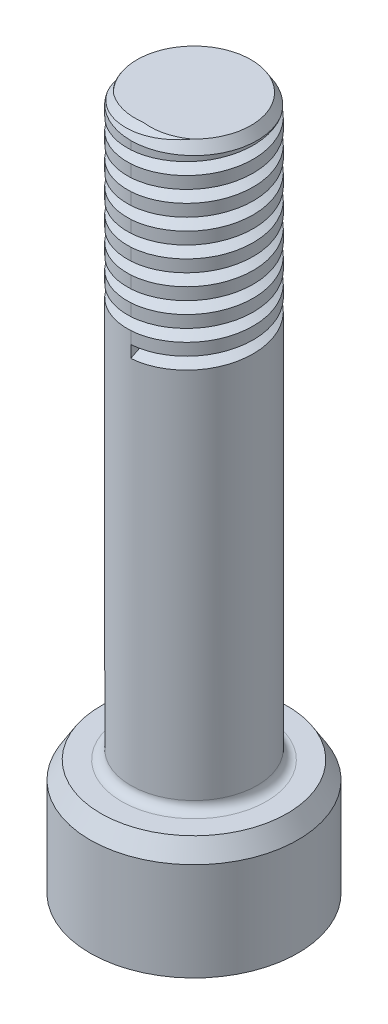
from build123d import *

# Parameters (mm, degrees)
CUT_SWEEP1_PITCH   = 0.793751588
CUT_EXTRUDE1_DEPTH = 1.955803912
FILLET1_R          = 0.30480061
FILLET2_R          = 0.396875794
CHAMFER3_SIZE      = 0.127


with BuildPart() as part:
    # Sketch1 → Revolve1 (revolve)
    with BuildSketch(Plane.XY, mode=Mode.PRIVATE) as revolve1_sk:
        Polygon((0, 0), (0, 23.215608331), (2.082804166, 23.215608331), (2.082804166, 4.165608331), (3.429006858, 4.165608331), (3.429006858, 0), align=None)
    revolve(revolve1_sk.sketch.rotate(Axis((0, 0, 0), (0, 1, 0)), 90), axis=Axis((0, 0, 0), (0, 1, 0)))

    # Cut-Sweep1: arcs per turn and ends read off the stored shape
    # Cut-Sweep1: the profile of Sketch3 profile screwed along a right-hand helix through 9 turns, 8 arcs to a turn; built about Z, then put on its axis
    cut_sweep1_z = Axis((0, 0, 0), (0, 0, 1))
    cut_sweep1_corners = [(2.083104166, 0, -0.595163691), (2.083104166, 0, -0.992339484), (1.685928372, 0, -0.793751588)]
    with BuildLine(mode=Mode.PRIVATE) as cut_sweep1_profile:
        Line(cut_sweep1_corners[0], cut_sweep1_corners[1])
        Line(cut_sweep1_corners[1], cut_sweep1_corners[2])
        Line(cut_sweep1_corners[2], cut_sweep1_corners[0])
    cut_sweep1_cap = Face(cut_sweep1_profile.wire())
    cut_sweep1_turn_angles = [0, 22.5, 45, 67.5, 90, 112.5, 135, 157.5, 180, 202.5, 225, 247.5, 270, 292.5, 315, 337.5, 360]
    cut_sweep1_turn_weights = [1, 0.9238795325112867, 1, 0.9238795325112867, 1, 0.9238795325112867, 1, 0.9238795325112867, 1, 0.9238795325112867, 1, 0.9238795325112867, 1, 0.9238795325112867, 1, 0.9238795325112867, 1]
    cut_sweep1_turn_rails = [Edge.make_bspline([Vector(p[0], p[1], 0).rotate(cut_sweep1_z, cut_sweep1_turn_angles[k]) / cut_sweep1_turn_weights[k] + Vector(0, 0, p[2] + CUT_SWEEP1_PITCH * cut_sweep1_turn_angles[k] / 360) for k in range(17)], [0, 0, 0, 1, 1, 2, 2, 3, 3, 4, 4, 5, 5, 6, 6, 7, 7, 8, 8, 8], 2, cut_sweep1_turn_weights) for p in cut_sweep1_corners]
    cut_sweep1_turn_sides = [Face.make_surface_from_curves(cut_sweep1_turn_rails[p[0]], cut_sweep1_turn_rails[p[1]]) for p in [(0, 1), (1, 2), (2, 0)]]
    cut_sweep1 = Plane(origin=(0, 23.215608331, 0), x_dir=(0, 0, 1), z_dir=(0, -1, 0)) * Solid(Shell([*[p.moved(Location((0, 0, CUT_SWEEP1_PITCH * i))) for i in range(9) for p in cut_sweep1_turn_sides], cut_sweep1_cap, cut_sweep1_cap.rotate(cut_sweep1_z, 3240).moved(Location((0, 0, CUT_SWEEP1_PITCH * 3240 / 360)))]))
    add(cut_sweep1, mode=Mode.SUBTRACT)

    # Sketch4 → Cut-Extrude1 (cut)
    with BuildSketch(Plane(origin=(0, 0, 0), x_dir=(1, 0, 0), z_dir=(0, 1, 0))):
        Polygon((0, 2.06772639), (-1.790703581, 1.033863195), (-1.790703581, -1.033863195), (0, -2.06772639), (1.790703581, -1.033863195), (1.790703581, 1.033863195), align=None)
    extrude(amount=CUT_EXTRUDE1_DEPTH, mode=Mode.SUBTRACT)

    # Fillet1
    fillet1_edges = [part.edges().sort_by_distance(p)[0] for p in [
        (0, 4.165608331, 2.082804166),
    ]]
    fillet(fillet1_edges, radius=FILLET1_R)

    # Fillet2
    fillet2_edges = [part.edges().sort_by_distance(p)[0] for p in [
        (1.790703581, 0.977901956, -1.033863195),
        (0, 0.977901956, -2.06772639),
        (-1.790703581, 0.977901956, -1.033863195),
        (-1.790703581, 0.977901956, 1.033863195),
        (0, 0.977901956, 2.06772639),
        (1.790703581, 0.977901956, 1.033863195),
        (0.895351791, 1.955803912, -1.550794792),
        (-0.895351791, 1.955803912, -1.550794792),
        (-1.790703581, 1.955803912, 0),
        (-0.895351791, 1.955803912, 1.550794792),
        (0.895351791, 1.955803912, 1.550794792),
        (1.790703581, 1.955803912, 0),
    ]]
    fillet(fillet2_edges, radius=FILLET2_R)

    # Chamfer1: read off the stored shape, not the designer's step
    # Chamfer1 outline → Chamfer1 (revolve, cut)
    with BuildSketch(Plane.XY):
        Polygon((2.082804166, 23.215608331), (1.879603759, 23.215608331), (2.082804166, 22.886469354), align=None)
    revolve(axis=Axis((0, 0, 0), (0, 1, 0)), mode=Mode.SUBTRACT)

    # Chamfer2: read off the stored shape, not the designer's step
    # Chamfer2 outline → Chamfer2 (revolve, cut)
    with BuildSketch(Plane.XY):
        Polygon((2.853013648, 0), (3.429006858, 0), (3.429006858, 0.355600711), align=None)
        Polygon((3.073406147, 4.165608331), (3.429006858, 3.589615121), (3.429006858, 4.165608331), align=None)
    revolve(axis=Axis((0, 0, 0), (0, 1, 0)), mode=Mode.SUBTRACT)

    # Chamfer3
    chamfer3_edges = [part.edges().sort_by_distance(p)[0] for p in [
        (0.895351791, 0, -1.550794792),
        (-0.895351791, 0, -1.550794792),
        (-1.790703581, 0, 0),
        (-0.895351791, 0, 1.550794792),
        (0.895351791, 0, 1.550794792),
        (1.790703581, 0, 0),
        (0, 0, -2.006329491),
        (1.737532307, 0, -1.003164745),
        (1.737532307, 0, 1.003164745),
        (0, 0, 2.006329491),
        (-1.737532307, 0, 1.003164745),
        (-1.737532307, 0, -1.003164745),
    ]]
    chamfer(chamfer3_edges, length=CHAMFER3_SIZE)


solid = part.part
